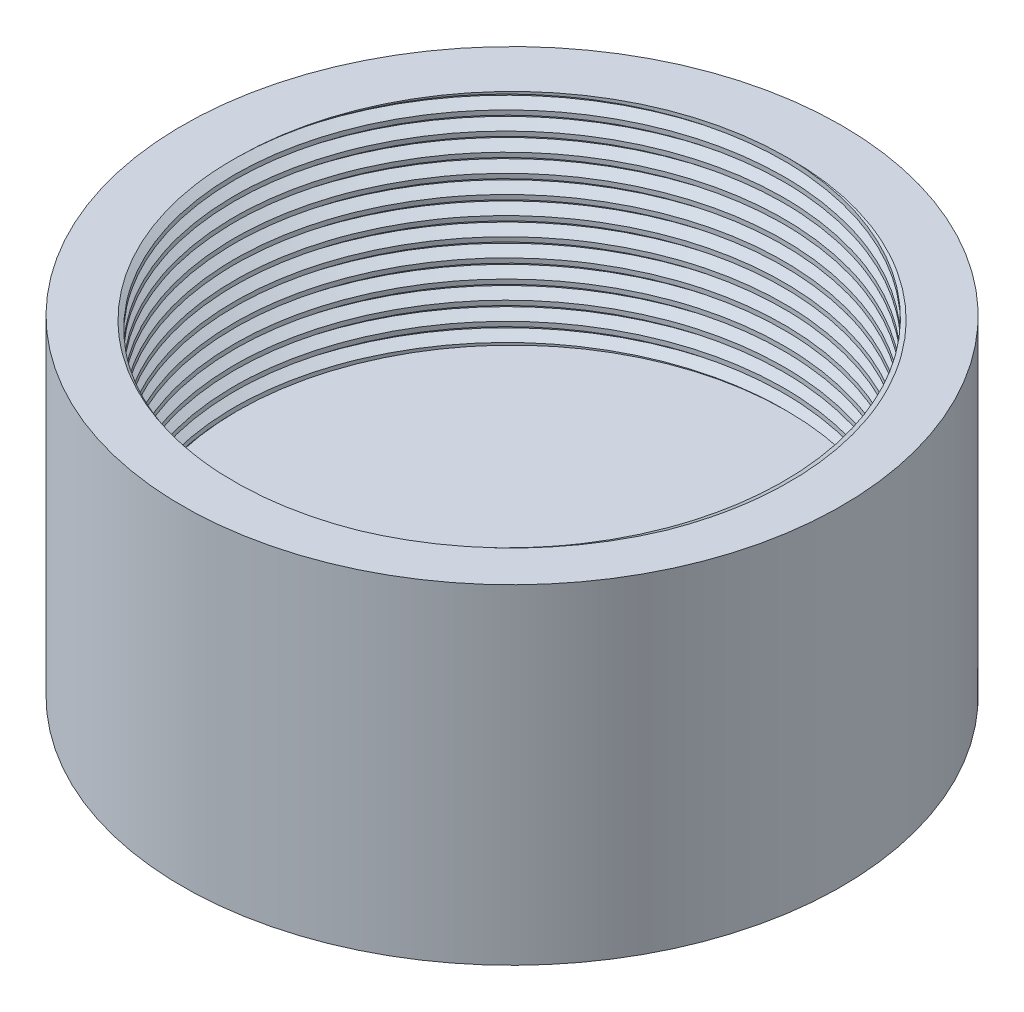
from build123d import *

# Parameters (mm, degrees)
SKETCH1_R           = 38.1
BOSS_EXTRUDE1_DEPTH = 38.1
SKETCH2_R           = 31.75
CUT_EXTRUDE1_DEPTH  = 25.4
THREAD1_PITCH       = 2.116666667


with BuildPart() as part:
    # Sketch1 → Boss-Extrude1 (new body)
    with BuildSketch(Plane(origin=(0, 0, 0), x_dir=(1, 0, 0), z_dir=(0, 1, 0))):
        with Locations(Location((0, 0, 0), (0, 0, 90))):
            Circle(SKETCH1_R)
    extrude(amount=BOSS_EXTRUDE1_DEPTH)

    # Sketch2 → Cut-Extrude1 (cut)
    with BuildSketch(Plane(origin=(0, 38.1, 0), x_dir=(1, 0, 0), z_dir=(0, 1, 0))):
        with Locations(Location((0, 0, 0), (0, 0, 270))):
            Circle(SKETCH2_R)
    extrude(amount=-CUT_EXTRUDE1_DEPTH, mode=Mode.SUBTRACT)

    # Thread1: the profile of Thread Profile1 profile screwed along a right-hand helix of 16.724409 turns, 10 arcs to a turn; built about Z, then put on its axis
    thread1_z = Axis((0, 0, 0), (0, 0, 1))
    thread1_corners = [(31.7497, 0, -0.000173205), (32.895679435, 0, 0.66145833), (32.895679435, 0, 0.926041664), (31.7497, 0, 1.587673199)]
    with BuildLine(mode=Mode.PRIVATE) as thread1_profile:
        Line(thread1_corners[0], thread1_corners[1])
        Line(thread1_corners[1], thread1_corners[2])
        Line(thread1_corners[2], thread1_corners[3])
        Line(thread1_corners[3], thread1_corners[0])
    thread1_cap = Face(thread1_profile.wire())
    thread1_turn_angles = [0, 18, 36, 54, 72, 90, 108, 126, 144, 162, 180, 198, 216, 234, 252, 270, 288, 306, 324, 342, 360]
    thread1_turn_weights = [1, 0.9510565162951535, 1, 0.9510565162951535, 1, 0.9510565162951535, 1, 0.9510565162951535, 1, 0.9510565162951535, 1, 0.9510565162951535, 1, 0.9510565162951535, 1, 0.9510565162951535, 1, 0.9510565162951535, 1, 0.9510565162951535, 1]
    thread1_turn_rails = [Edge.make_bspline([Vector(p[0], p[1], 0).rotate(thread1_z, thread1_turn_angles[k]) / thread1_turn_weights[k] + Vector(0, 0, p[2] + THREAD1_PITCH * thread1_turn_angles[k] / 360) for k in range(21)], [0, 0, 0, 1, 1, 2, 2, 3, 3, 4, 4, 5, 5, 6, 6, 7, 7, 8, 8, 9, 9, 10, 10, 10], 2, thread1_turn_weights) for p in thread1_corners]
    thread1_turn_sides = [Face.make_surface_from_curves(thread1_turn_rails[p[0]], thread1_turn_rails[p[1]]) for p in [(0, 1), (1, 2), (2, 3), (3, 0)]]
    thread1_last_angles = [5760, 5778, 5796, 5814, 5832, 5850, 5868, 5886, 5904, 5922, 5940, 5958, 5976, 5994, 6012, 6016.393700787, 6020.787401575]
    thread1_last_weights = [1, 0.9510565162951535, 1, 0.9510565162951535, 1, 0.9510565162951535, 1, 0.9510565162951535, 1, 0.9510565162951535, 1, 0.9510565162951535, 1, 0.9510565162951535, 1, 0.9970611808444931, 1]
    thread1_last_rails = [Edge.make_bspline([Vector(p[0], p[1], 0).rotate(thread1_z, thread1_last_angles[k]) / thread1_last_weights[k] + Vector(0, 0, p[2] + THREAD1_PITCH * thread1_last_angles[k] / 360) for k in range(17)], [0, 0, 0, 1, 1, 2, 2, 3, 3, 4, 4, 5, 5, 6, 6, 7, 7, 8, 8, 8], 2, thread1_last_weights) for p in thread1_corners]
    thread1_last_sides = [Face.make_surface_from_curves(thread1_last_rails[p[0]], thread1_last_rails[p[1]]) for p in [(0, 1), (1, 2), (2, 3), (3, 0)]]
    thread1 = Plane(origin=(0, 44.45, 0), x_dir=(-1, 0, 0), z_dir=(0, -1, 0)) * Solid(Shell([*[p.moved(Location((0, 0, THREAD1_PITCH * i))) for i in range(16) for p in thread1_turn_sides], *thread1_last_sides, thread1_cap, thread1_cap.rotate(thread1_z, 6020.787401575).moved(Location((0, 0, THREAD1_PITCH * 6020.787401575 / 360)))]))
    add(thread1, mode=Mode.SUBTRACT)


solid = part.part
